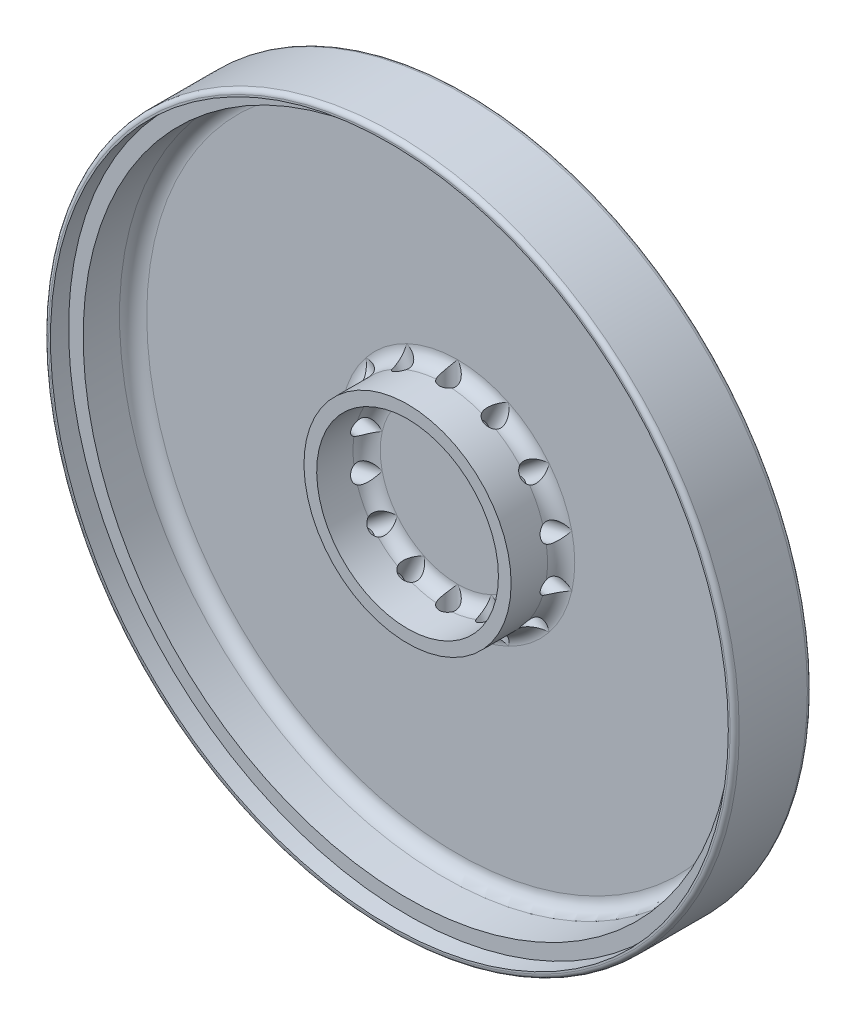
from build123d import *

# Parameters (mm, degrees)
SKETCH1_R                      = 76
SKETCH1_R_2                    = 74.6
SKETCH1_R_3                    = 71.4
SKETCH1_R_4                    = 22.8
SKETCH1_R_5                    = 20
BOSS_EXTRUDE1_DEPTH            = 2
BOSS_EXTRUDE2_START            = 15
SKETCH1_3_R                    = 76
SKETCH1_3_R_2                  = 74.6
BOSS_EXTRUDE2_DEPTH            = 15
BOSS_EXTRUDE3_START            = 11
SKETCH1_4_R                    = 74.6
SKETCH1_4_R_2                  = 71.4
BOSS_EXTRUDE3_DEPTH            = 11
SKETCH1_5_R                    = 22.8
SKETCH1_5_R_2                  = 20
BOSS_EXTRUDE4_DEPTH            = 11
CUT_EXTRUDE3_REACH             = 110.522
SKETCH2_R                      = 2
CUT_EXTRUDE3_DIRECTION_2_REACH = 110.522
FILLET1_R                      = 3
FILLET2_R                      = 3
FILLET3_R                      = 1
FILLET4_R                      = 1
CIRPATTERN1_COUNT              = 7


with BuildPart() as part:
    # Sketch1 → Boss-Extrude1 (new body)
    # profile 1 of 5: a face of its own
    with BuildSketch(Plane.XY):
        Circle(SKETCH1_R)
        Circle(SKETCH1_R_2, mode=Mode.SUBTRACT)
    # profile 2 of 5: a face of its own
    with BuildSketch(Plane.XY):
        Circle(SKETCH1_R_2)
        Circle(SKETCH1_R_3, mode=Mode.SUBTRACT)
    # profile 3 of 5: a face of its own
    with BuildSketch(Plane.XY):
        Circle(SKETCH1_R_3)
        Circle(SKETCH1_R_4, mode=Mode.SUBTRACT)
    # profile 4 of 5: a face of its own
    with BuildSketch(Plane.XY):
        Circle(SKETCH1_R_4)
        Circle(SKETCH1_R_5, mode=Mode.SUBTRACT)
    # profile 5 of 5: a face of its own
    with BuildSketch(Plane.XY):
        Circle(SKETCH1_R_5)
    extrude(amount=-BOSS_EXTRUDE1_DEPTH)

    # Sketch1<3> → Boss-Extrude2 (add)
    with BuildSketch(Plane.XY.offset(BOSS_EXTRUDE2_START)):
        Circle(SKETCH1_3_R)
        Circle(SKETCH1_3_R_2, mode=Mode.SUBTRACT)
    extrude(amount=-BOSS_EXTRUDE2_DEPTH)

    # Sketch1<4> → Boss-Extrude3 (add)
    with BuildSketch(Plane.XY.offset(BOSS_EXTRUDE3_START)):
        Circle(SKETCH1_4_R)
        Circle(SKETCH1_4_R_2, mode=Mode.SUBTRACT)
    extrude(amount=-BOSS_EXTRUDE3_DEPTH)

    # Sketch1<5> → Boss-Extrude4 (add)
    with BuildSketch(Plane.XY):
        Circle(SKETCH1_5_R)
        Circle(SKETCH1_5_R_2, mode=Mode.SUBTRACT)
    extrude(amount=BOSS_EXTRUDE4_DEPTH)

    # Sketch2 → Cut-Extrude3 (cut, up to next)
    with BuildSketch(Plane(origin=(0, 0, 0), x_dir=(1, 0, 0), z_dir=(0, 1, 0)), mode=Mode.PRIVATE) as cut_extrude3_sk1:
        with Locations(Location((0, -2, 0), (0, 0, 90))):
            Circle(SKETCH2_R)
    cut_extrude3_tool1 = extrude(cut_extrude3_sk1.sketch, amount=-CUT_EXTRUDE3_REACH, mode=Mode.PRIVATE) & part.part
    cut_extrude3 = cut_extrude3_tool1.solids().sort_by_distance((0, 0, 2))[0]
    add(cut_extrude3, mode=Mode.SUBTRACT)

    # Sketch2 → Cut-Extrude3 direction 2 (cut, up to next)
    with BuildSketch(Plane(origin=(0, 0, 0), x_dir=(1, 0, 0), z_dir=(0, 1, 0)), mode=Mode.PRIVATE) as cut_extrude3_direction_2_sk1:
        with Locations(Location((0, -2, 0), (0, 0, 90))):
            Circle(SKETCH2_R)
    cut_extrude3_direction_2_tool1 = extrude(cut_extrude3_direction_2_sk1.sketch, amount=CUT_EXTRUDE3_DIRECTION_2_REACH, mode=Mode.PRIVATE) & part.part
    cut_extrude3_direction_2 = cut_extrude3_direction_2_tool1.solids().sort_by_distance((0, 0, 2))[0]
    add(cut_extrude3_direction_2, mode=Mode.SUBTRACT)

    # Fillet1
    fillet1_edges = [part.edges().sort_by_distance(p)[0] for p in [
        (-71.4, 0, 0),
    ]]
    fillet(fillet1_edges, radius=FILLET1_R)

    # Fillet2
    # the kernel refuses this fillet: 3 mm, written as the material it adds along each edge
    with BuildSketch(Plane(origin=(0, 0, 0), x_dir=(1, 0, 0), z_dir=(0, -1, 0))) as fillet2_piece_1_section:
        with BuildLine():
            CenterArc((20 - FILLET2_R, FILLET2_R), FILLET2_R, 270, 90)
            Line((20 - FILLET2_R, 0), (20, 0))
            Line((20, 0), (20, FILLET2_R))
        make_face()
    fillet2_piece_1 = revolve(axis=Axis((0, 0, 0), (0, 0, 1)), revolution_arc=90, mode=Mode.PRIVATE)
    fillet2_piece_1 = fillet2_piece_1 - Plane(origin=(0, 0, 2), x_dir=(0, 0, -1), z_dir=(0, -1, 0)) * Cylinder(2, 80, mode=Mode.PRIVATE)
    add(fillet2_piece_1)
    with BuildSketch(Plane(origin=(0, 0, 0), x_dir=(0, 1, 0), z_dir=(1, 0, 0))) as fillet2_piece_2_section:
        with BuildLine():
            CenterArc((22.8 + FILLET2_R, FILLET2_R), FILLET2_R, 180, 90)
            Line((22.8, FILLET2_R), (22.8, 0))
            Line((22.8, 0), (22.8 + FILLET2_R, 0))
        make_face()
    fillet2_piece_2 = revolve(axis=Axis((0, 0, 0), (0, 0, 1)), revolution_arc=180, mode=Mode.PRIVATE)
    fillet2_piece_2 = fillet2_piece_2 - Plane(origin=(0, 0, 2), x_dir=(0, 0, -1), z_dir=(0, -1, 0)) * Cylinder(2, 104, mode=Mode.PRIVATE)
    add(fillet2_piece_2)
    with BuildSketch(Plane(origin=(0, 0, 0), x_dir=(0, 1, 0), z_dir=(1, 0, 0))) as fillet2_piece_3_section:
        with BuildLine():
            CenterArc((20 - FILLET2_R, FILLET2_R), FILLET2_R, 270, 90)
            Line((20 - FILLET2_R, 0), (20, 0))
            Line((20, 0), (20, FILLET2_R))
        make_face()
    fillet2_piece_3 = revolve(axis=Axis((0, 0, 0), (0, 0, 1)), revolution_arc=180, mode=Mode.PRIVATE)
    fillet2_piece_3 = fillet2_piece_3 - Plane(origin=(0, 0, 2), x_dir=(0, 0, -1), z_dir=(0, -1, 0)) * Cylinder(2, 80, mode=Mode.PRIVATE)
    add(fillet2_piece_3)
    with BuildSketch(Plane(origin=(0, 0, 0), x_dir=(0, -1, 0), z_dir=(-1, 0, 0))) as fillet2_piece_4_section:
        with BuildLine():
            CenterArc((22.8 + FILLET2_R, FILLET2_R), FILLET2_R, 180, 90)
            Line((22.8, FILLET2_R), (22.8, 0))
            Line((22.8, 0), (22.8 + FILLET2_R, 0))
        make_face()
    fillet2_piece_4 = revolve(axis=Axis((0, 0, 0), (0, 0, 1)), revolution_arc=90, mode=Mode.PRIVATE)
    fillet2_piece_4 = fillet2_piece_4 - Plane(origin=(0, 0, 2), x_dir=(0, 0, -1), z_dir=(0, 1, 0)) * Cylinder(2, 104, mode=Mode.PRIVATE)
    add(fillet2_piece_4)
    with BuildSketch(Plane(origin=(0, 0, 0), x_dir=(1, 0, 0), z_dir=(0, -1, 0))) as fillet2_piece_5_section:
        with BuildLine():
            CenterArc((22.8 + FILLET2_R, FILLET2_R), FILLET2_R, 180, 90)
            Line((22.8, FILLET2_R), (22.8, 0))
            Line((22.8, 0), (22.8 + FILLET2_R, 0))
        make_face()
    fillet2_piece_5 = revolve(axis=Axis((0, 0, 0), (0, 0, 1)), revolution_arc=90, mode=Mode.PRIVATE)
    fillet2_piece_5 = fillet2_piece_5 - Plane(origin=(0, 0, 2), x_dir=(0, 0, -1), z_dir=(0, -1, 0)) * Cylinder(2, 104, mode=Mode.PRIVATE)
    add(fillet2_piece_5)
    with BuildSketch(Plane(origin=(0, 0, 0), x_dir=(0, -1, 0), z_dir=(-1, 0, 0))) as fillet2_piece_6_section:
        with BuildLine():
            CenterArc((20 - FILLET2_R, FILLET2_R), FILLET2_R, 270, 90)
            Line((20 - FILLET2_R, 0), (20, 0))
            Line((20, 0), (20, FILLET2_R))
        make_face()
    fillet2_piece_6 = revolve(axis=Axis((0, 0, 0), (0, 0, 1)), revolution_arc=90, mode=Mode.PRIVATE)
    fillet2_piece_6 = fillet2_piece_6 - Plane(origin=(0, 0, 2), x_dir=(0, 0, -1), z_dir=(0, 1, 0)) * Cylinder(2, 80, mode=Mode.PRIVATE)
    add(fillet2_piece_6)

    # Fillet3
    fillet3_edges = [part.edges().sort_by_distance(p)[0] for p in [
        (-76, 0, -2),
    ]]
    fillet(fillet3_edges, radius=FILLET3_R)

    # Fillet4
    fillet4_edges = [part.edges().sort_by_distance(p)[0] for p in [
        (-76, 0, 15),
    ]]
    fillet(fillet4_edges, radius=FILLET4_R)

    # CirPattern1: Cut-Extrude3, Cut-Extrude3 direction 2; each copy of Cut-Extrude3, Cut-Extrude3 direction 2 runs up to whatever stops it at its own place
    cirpattern1_before = part.part  # the part as the pattern finds it: every copy runs up to it
    cirpattern1_cut_extrude3_long = extrude(cut_extrude3_sk1.sketch, amount=-CUT_EXTRUDE3_REACH, mode=Mode.PRIVATE)
    cirpattern1_cut_extrude3_tool1 = cirpattern1_cut_extrude3_long.rotate(Axis((0, 0, 11), (0, 0, -1)), 1 * 360 / CIRPATTERN1_COUNT) & cirpattern1_before
    add(cirpattern1_cut_extrude3_tool1.solids().sort_by_distance((0, 0, 2))[0], mode=Mode.SUBTRACT)
    cirpattern1_cut_extrude3_tool2 = cirpattern1_cut_extrude3_long.rotate(Axis((0, 0, 11), (0, 0, -1)), 2 * 360 / CIRPATTERN1_COUNT) & cirpattern1_before
    add(cirpattern1_cut_extrude3_tool2.solids().sort_by_distance((0, 0, 2))[0], mode=Mode.SUBTRACT)
    cirpattern1_cut_extrude3_tool3 = cirpattern1_cut_extrude3_long.rotate(Axis((0, 0, 11), (0, 0, -1)), 3 * 360 / CIRPATTERN1_COUNT) & cirpattern1_before
    add(cirpattern1_cut_extrude3_tool3.solids().sort_by_distance((0, 0, 2))[0], mode=Mode.SUBTRACT)
    cirpattern1_cut_extrude3_tool4 = cirpattern1_cut_extrude3_long.rotate(Axis((0, 0, 11), (0, 0, -1)), 4 * 360 / CIRPATTERN1_COUNT) & cirpattern1_before
    add(cirpattern1_cut_extrude3_tool4.solids().sort_by_distance((0, 0, 2))[0], mode=Mode.SUBTRACT)
    cirpattern1_cut_extrude3_tool5 = cirpattern1_cut_extrude3_long.rotate(Axis((0, 0, 11), (0, 0, -1)), 5 * 360 / CIRPATTERN1_COUNT) & cirpattern1_before
    add(cirpattern1_cut_extrude3_tool5.solids().sort_by_distance((0, 0, 2))[0], mode=Mode.SUBTRACT)
    cirpattern1_cut_extrude3_tool6 = cirpattern1_cut_extrude3_long.rotate(Axis((0, 0, 11), (0, 0, -1)), 6 * 360 / CIRPATTERN1_COUNT) & cirpattern1_before
    add(cirpattern1_cut_extrude3_tool6.solids().sort_by_distance((0, 0, 2))[0], mode=Mode.SUBTRACT)
    cirpattern1_cut_extrude3_direction_2_long = extrude(cut_extrude3_direction_2_sk1.sketch, amount=CUT_EXTRUDE3_DIRECTION_2_REACH, mode=Mode.PRIVATE)
    cirpattern1_cut_extrude3_direction_2_tool1 = cirpattern1_cut_extrude3_direction_2_long.rotate(Axis((0, 0, 11), (0, 0, -1)), 1 * 360 / CIRPATTERN1_COUNT) & cirpattern1_before
    add(cirpattern1_cut_extrude3_direction_2_tool1.solids().sort_by_distance((0, 0, 2))[0], mode=Mode.SUBTRACT)
    cirpattern1_cut_extrude3_direction_2_tool2 = cirpattern1_cut_extrude3_direction_2_long.rotate(Axis((0, 0, 11), (0, 0, -1)), 2 * 360 / CIRPATTERN1_COUNT) & cirpattern1_before
    add(cirpattern1_cut_extrude3_direction_2_tool2.solids().sort_by_distance((0, 0, 2))[0], mode=Mode.SUBTRACT)
    cirpattern1_cut_extrude3_direction_2_tool3 = cirpattern1_cut_extrude3_direction_2_long.rotate(Axis((0, 0, 11), (0, 0, -1)), 3 * 360 / CIRPATTERN1_COUNT) & cirpattern1_before
    add(cirpattern1_cut_extrude3_direction_2_tool3.solids().sort_by_distance((0, 0, 2))[0], mode=Mode.SUBTRACT)
    cirpattern1_cut_extrude3_direction_2_tool4 = cirpattern1_cut_extrude3_direction_2_long.rotate(Axis((0, 0, 11), (0, 0, -1)), 4 * 360 / CIRPATTERN1_COUNT) & cirpattern1_before
    add(cirpattern1_cut_extrude3_direction_2_tool4.solids().sort_by_distance((0, 0, 2))[0], mode=Mode.SUBTRACT)
    cirpattern1_cut_extrude3_direction_2_tool5 = cirpattern1_cut_extrude3_direction_2_long.rotate(Axis((0, 0, 11), (0, 0, -1)), 5 * 360 / CIRPATTERN1_COUNT) & cirpattern1_before
    add(cirpattern1_cut_extrude3_direction_2_tool5.solids().sort_by_distance((0, 0, 2))[0], mode=Mode.SUBTRACT)
    cirpattern1_cut_extrude3_direction_2_tool6 = cirpattern1_cut_extrude3_direction_2_long.rotate(Axis((0, 0, 11), (0, 0, -1)), 6 * 360 / CIRPATTERN1_COUNT) & cirpattern1_before
    add(cirpattern1_cut_extrude3_direction_2_tool6.solids().sort_by_distance((0, 0, 2))[0], mode=Mode.SUBTRACT)


solid = part.part
